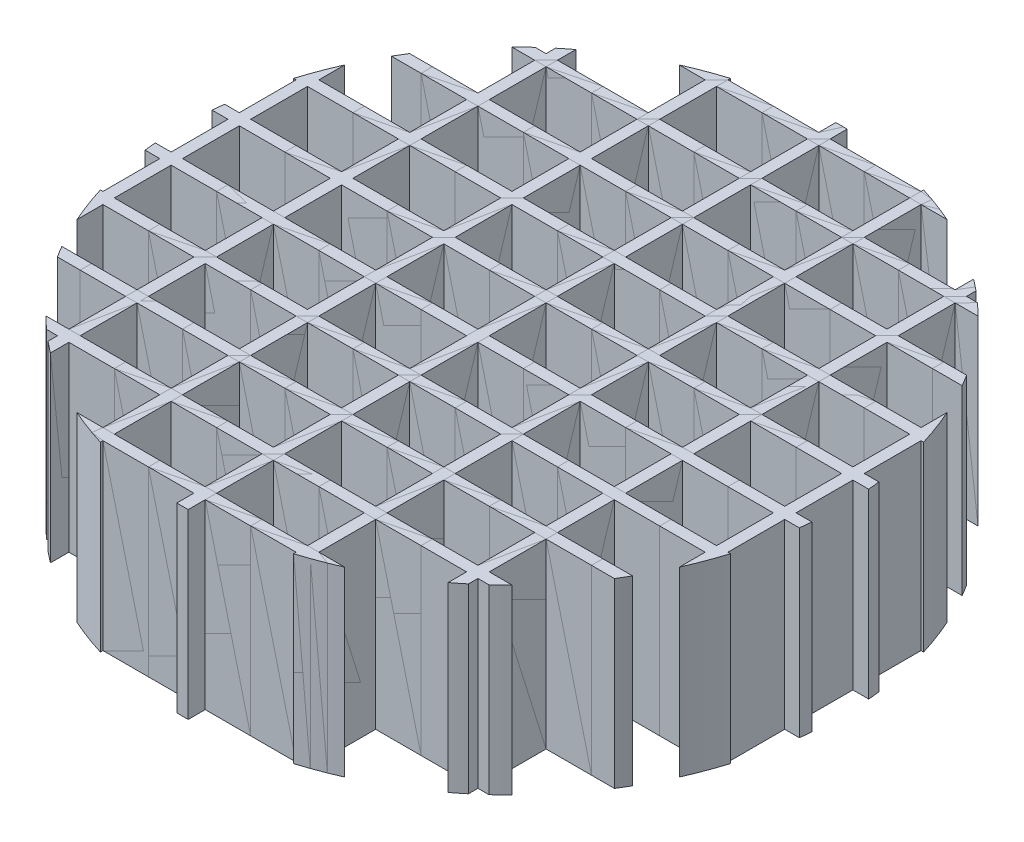
from build123d import *

# Parameters (mm, degrees)
SKETCH1_W                  = 3.175
SKETCH1_H                  = 190.5
BOSS_EXTRUDE1_DEPTH        = 50.8
SKETCH2_W                  = 3.175
SKETCH2_H                  = 50.8
BOSS_EXTRUDE2_DEPTH        = 12.7
LPATTERN1_COUNT            = 10
LPATTERN1_PITCH            = 19.05
LPATTERN2_COPY_1_SKETCH_W  = 3.175
LPATTERN2_COPY_1_SKETCH_H  = 50.8
LPATTERN2_COPY_1_DEPTH     = 12.7
LPATTERN2_COPY_2_SKETCH_W  = 3.175
LPATTERN2_COPY_2_SKETCH_H  = 50.8
LPATTERN2_COPY_2_DEPTH     = 12.7
LPATTERN2_COPY_3_SKETCH_W  = 3.175
LPATTERN2_COPY_3_SKETCH_H  = 50.8
LPATTERN2_COPY_3_DEPTH     = 12.7
LPATTERN2_COPY_4_SKETCH_W  = 3.175
LPATTERN2_COPY_4_SKETCH_H  = 50.8
LPATTERN2_COPY_4_DEPTH     = 12.7
LPATTERN2_COPY_5_SKETCH_W  = 3.175
LPATTERN2_COPY_5_SKETCH_H  = 50.8
LPATTERN2_COPY_5_DEPTH     = 12.7
LPATTERN2_COPY_6_SKETCH_W  = 3.175
LPATTERN2_COPY_6_SKETCH_H  = 50.8
LPATTERN2_COPY_6_DEPTH     = 12.7
LPATTERN2_COPY_7_SKETCH_W  = 3.175
LPATTERN2_COPY_7_SKETCH_H  = 50.8
LPATTERN2_COPY_7_DEPTH     = 12.7
LPATTERN2_COPY_8_SKETCH_W  = 3.175
LPATTERN2_COPY_8_SKETCH_H  = 50.8
LPATTERN2_COPY_8_DEPTH     = 12.7
LPATTERN2_COPY_9_SKETCH_W  = 3.175
LPATTERN2_COPY_9_SKETCH_H  = 50.8
LPATTERN2_COPY_9_DEPTH     = 12.7
LPATTERN2_COPY_10_SKETCH_W = 3.175
LPATTERN2_COPY_10_SKETCH_H = 50.8
LPATTERN2_COPY_10_DEPTH    = 12.7
LPATTERN3_COUNT            = 4
LPATTERN3_PITCH            = 28.575
LPATTERN3_2_COUNT          = 4
LPATTERN3_2_PITCH          = 28.575
SKETCH3_R                  = 152.4
SKETCH3_R_2                = 92.075
CUT_EXTRUDE1_DEPTH         = 148.158766834


with BuildPart() as part:
    # Sketch1 → Boss-Extrude1 (new body)
    with BuildSketch(Plane(origin=(0, 0, 0), x_dir=(1, 0, 0), z_dir=(0, 1, 0))):
        Rectangle(SKETCH1_W, SKETCH1_H)
    extrude(amount=BOSS_EXTRUDE1_DEPTH)

    # Sketch2 → Boss-Extrude2 (add)
    with BuildSketch(Plane(origin=(1.5875, 0, 0), x_dir=(0, 0, -1), z_dir=(1, 0, 0))):
        with Locations((-85.725, 25.4)):
            Rectangle(SKETCH2_W, SKETCH2_H)
    boss_extrude2 = extrude(amount=BOSS_EXTRUDE2_DEPTH)

    # LPattern1: Boss-Extrude2 ×10
    with Locations(*[(0, 0, -i * LPATTERN1_PITCH) for i in range(1, LPATTERN1_COUNT)]):
        add(boss_extrude2)

    # LPattern2 copy 1 sketch → LPattern2 copy 1 (add)
    with BuildSketch(Plane(origin=(-14.2875, 0, -19.05), x_dir=(0, 0, -1), z_dir=(1, 0, 0))):
        with Locations((-85.725, 25.4)):
            Rectangle(LPATTERN2_COPY_1_SKETCH_W, LPATTERN2_COPY_1_SKETCH_H)
    extrude(amount=LPATTERN2_COPY_1_DEPTH)

    # LPattern2 copy 2 sketch → LPattern2 copy 2 (add)
    with BuildSketch(Plane(origin=(-14.2875, 0, -38.1), x_dir=(0, 0, -1), z_dir=(1, 0, 0))):
        with Locations((-85.725, 25.4)):
            Rectangle(LPATTERN2_COPY_2_SKETCH_W, LPATTERN2_COPY_2_SKETCH_H)
    extrude(amount=LPATTERN2_COPY_2_DEPTH)

    # LPattern2 copy 3 sketch → LPattern2 copy 3 (add)
    with BuildSketch(Plane(origin=(-14.2875, 0, -57.15), x_dir=(0, 0, -1), z_dir=(1, 0, 0))):
        with Locations((-85.725, 25.4)):
            Rectangle(LPATTERN2_COPY_3_SKETCH_W, LPATTERN2_COPY_3_SKETCH_H)
    extrude(amount=LPATTERN2_COPY_3_DEPTH)

    # LPattern2 copy 4 sketch → LPattern2 copy 4 (add)
    with BuildSketch(Plane(origin=(-14.2875, 0, -76.2), x_dir=(0, 0, -1), z_dir=(1, 0, 0))):
        with Locations((-85.725, 25.4)):
            Rectangle(LPATTERN2_COPY_4_SKETCH_W, LPATTERN2_COPY_4_SKETCH_H)
    extrude(amount=LPATTERN2_COPY_4_DEPTH)

    # LPattern2 copy 5 sketch → LPattern2 copy 5 (add)
    with BuildSketch(Plane(origin=(-14.2875, 0, -95.25), x_dir=(0, 0, -1), z_dir=(1, 0, 0))):
        with Locations((-85.725, 25.4)):
            Rectangle(LPATTERN2_COPY_5_SKETCH_W, LPATTERN2_COPY_5_SKETCH_H)
    extrude(amount=LPATTERN2_COPY_5_DEPTH)

    # LPattern2 copy 6 sketch → LPattern2 copy 6 (add)
    with BuildSketch(Plane(origin=(-14.2875, 0, -114.3), x_dir=(0, 0, -1), z_dir=(1, 0, 0))):
        with Locations((-85.725, 25.4)):
            Rectangle(LPATTERN2_COPY_6_SKETCH_W, LPATTERN2_COPY_6_SKETCH_H)
    extrude(amount=LPATTERN2_COPY_6_DEPTH)

    # LPattern2 copy 7 sketch → LPattern2 copy 7 (add)
    with BuildSketch(Plane(origin=(-14.2875, 0, -133.35), x_dir=(0, 0, -1), z_dir=(1, 0, 0))):
        with Locations((-85.725, 25.4)):
            Rectangle(LPATTERN2_COPY_7_SKETCH_W, LPATTERN2_COPY_7_SKETCH_H)
    extrude(amount=LPATTERN2_COPY_7_DEPTH)

    # LPattern2 copy 8 sketch → LPattern2 copy 8 (add)
    with BuildSketch(Plane(origin=(-14.2875, 0, -152.4), x_dir=(0, 0, -1), z_dir=(1, 0, 0))):
        with Locations((-85.725, 25.4)):
            Rectangle(LPATTERN2_COPY_8_SKETCH_W, LPATTERN2_COPY_8_SKETCH_H)
    extrude(amount=LPATTERN2_COPY_8_DEPTH)

    # LPattern2 copy 9 sketch → LPattern2 copy 9 (add)
    with BuildSketch(Plane(origin=(-14.2875, 0, -171.45), x_dir=(0, 0, -1), z_dir=(1, 0, 0))):
        with Locations((-85.725, 25.4)):
            Rectangle(LPATTERN2_COPY_9_SKETCH_W, LPATTERN2_COPY_9_SKETCH_H)
    extrude(amount=LPATTERN2_COPY_9_DEPTH)

    # LPattern2 copy 10 sketch → LPattern2 copy 10 (add)
    with BuildSketch(Plane(origin=(-14.2875, 0, 0), x_dir=(0, 0, -1), z_dir=(1, 0, 0))):
        with Locations((-85.725, 25.4)):
            Rectangle(LPATTERN2_COPY_10_SKETCH_W, LPATTERN2_COPY_10_SKETCH_H)
    extrude(amount=LPATTERN2_COPY_10_DEPTH)


with BuildPart() as lpattern3_1:
    # LPattern3: pattern copy
    add(part.part.moved(Location(Vector(1, 0, 0) * (1 * LPATTERN3_PITCH))))


with BuildPart() as lpattern3_2:
    # LPattern3: pattern copy
    add(part.part.moved(Location(Vector(1, 0, 0) * (2 * LPATTERN3_PITCH))))


with BuildPart() as lpattern3_3:
    # LPattern3: pattern copy
    add(part.part.moved(Location(Vector(1, 0, 0) * (3 * LPATTERN3_PITCH))))


with BuildPart() as lpattern3_2_1:
    # LPattern3 2: pattern copy
    add(part.part.moved(Location(Vector(-1, 0, 0) * (1 * LPATTERN3_2_PITCH))))


with BuildPart() as lpattern3_2_2:
    # LPattern3 2: pattern copy
    add(part.part.moved(Location(Vector(-1, 0, 0) * (2 * LPATTERN3_2_PITCH))))


with BuildPart() as lpattern3_2_3:
    # LPattern3 2: pattern copy
    add(part.part.moved(Location(Vector(-1, 0, 0) * (3 * LPATTERN3_2_PITCH))))


with BuildPart() as lpattern3_2_4:
    # LPattern3 2: pattern copy
    add(lpattern3_1.part.moved(Location(Vector(-1, 0, 0) * (1 * LPATTERN3_2_PITCH))))


with BuildPart() as lpattern3_2_5:
    # LPattern3 2: pattern copy
    add(lpattern3_1.part.moved(Location(Vector(-1, 0, 0) * (2 * LPATTERN3_2_PITCH))))


with BuildPart() as lpattern3_2_6:
    # LPattern3 2: pattern copy
    add(lpattern3_1.part.moved(Location(Vector(-1, 0, 0) * (3 * LPATTERN3_2_PITCH))))


with BuildPart() as lpattern3_2_7:
    # LPattern3 2: pattern copy
    add(lpattern3_2.part.moved(Location(Vector(-1, 0, 0) * (1 * LPATTERN3_2_PITCH))))


with BuildPart() as lpattern3_2_8:
    # LPattern3 2: pattern copy
    add(lpattern3_2.part.moved(Location(Vector(-1, 0, 0) * (2 * LPATTERN3_2_PITCH))))


with BuildPart() as lpattern3_2_9:
    # LPattern3 2: pattern copy
    add(lpattern3_2.part.moved(Location(Vector(-1, 0, 0) * (3 * LPATTERN3_2_PITCH))))


with BuildPart() as lpattern3_2_10:
    # LPattern3 2: pattern copy
    add(lpattern3_3.part.moved(Location(Vector(-1, 0, 0) * (1 * LPATTERN3_2_PITCH))))


with BuildPart() as lpattern3_2_11:
    # LPattern3 2: pattern copy
    add(lpattern3_3.part.moved(Location(Vector(-1, 0, 0) * (2 * LPATTERN3_2_PITCH))))


with BuildPart() as lpattern3_2_12:
    # LPattern3 2: pattern copy
    add(lpattern3_3.part.moved(Location(Vector(-1, 0, 0) * (3 * LPATTERN3_2_PITCH))))


with BuildPart() as cut_extrude1_tool:
    # Sketch3 → Cut-Extrude1 (new, through all)
    with BuildSketch(Plane(origin=(0, 50.8, 0), x_dir=(1, 0, 0), z_dir=(0, 1, 0))):
        Circle(SKETCH3_R)
        Circle(SKETCH3_R_2, mode=Mode.SUBTRACT)
    extrude(amount=-CUT_EXTRUDE1_DEPTH)


with BuildPart() as part_1:
    add(part.part)

    # Cut-Extrude1: cut by cut_extrude1_tool
    add(cut_extrude1_tool.part, mode=Mode.SUBTRACT)


with BuildPart() as lpattern3_1_1:
    add(lpattern3_1.part)

    # Cut-Extrude1: cut by cut_extrude1_tool
    add(cut_extrude1_tool.part, mode=Mode.SUBTRACT)


with BuildPart() as lpattern3_2_13:
    add(lpattern3_2.part)

    # Cut-Extrude1: cut by cut_extrude1_tool
    add(cut_extrude1_tool.part, mode=Mode.SUBTRACT)


with BuildPart() as lpattern3_3_1:
    add(lpattern3_3.part)

    # Cut-Extrude1: cut by cut_extrude1_tool
    add(cut_extrude1_tool.part, mode=Mode.SUBTRACT)


with BuildPart() as lpattern3_2_1_1:
    add(lpattern3_2_1.part)

    # Cut-Extrude1: cut by cut_extrude1_tool
    add(cut_extrude1_tool.part, mode=Mode.SUBTRACT)


with BuildPart() as lpattern3_2_2_1:
    add(lpattern3_2_2.part)

    # Cut-Extrude1: cut by cut_extrude1_tool
    add(cut_extrude1_tool.part, mode=Mode.SUBTRACT)


with BuildPart() as lpattern3_2_3_1:
    add(lpattern3_2_3.part)

    # Cut-Extrude1: cut by cut_extrude1_tool
    add(cut_extrude1_tool.part, mode=Mode.SUBTRACT)


with BuildPart() as lpattern3_2_4_1:
    add(lpattern3_2_4.part)

    # Cut-Extrude1: cut by cut_extrude1_tool
    add(cut_extrude1_tool.part, mode=Mode.SUBTRACT)


with BuildPart() as lpattern3_2_5_1:
    add(lpattern3_2_5.part)

    # Cut-Extrude1: cut by cut_extrude1_tool
    add(cut_extrude1_tool.part, mode=Mode.SUBTRACT)


with BuildPart() as lpattern3_2_6_1:
    add(lpattern3_2_6.part)

    # Cut-Extrude1: cut by cut_extrude1_tool
    add(cut_extrude1_tool.part, mode=Mode.SUBTRACT)


with BuildPart() as lpattern3_2_7_1:
    add(lpattern3_2_7.part)

    # Cut-Extrude1: cut by cut_extrude1_tool
    add(cut_extrude1_tool.part, mode=Mode.SUBTRACT)


with BuildPart() as lpattern3_2_8_1:
    add(lpattern3_2_8.part)

    # Cut-Extrude1: cut by cut_extrude1_tool
    add(cut_extrude1_tool.part, mode=Mode.SUBTRACT)


with BuildPart() as lpattern3_2_9_1:
    add(lpattern3_2_9.part)

    # Cut-Extrude1: cut by cut_extrude1_tool
    add(cut_extrude1_tool.part, mode=Mode.SUBTRACT)


with BuildPart() as lpattern3_2_10_1:
    add(lpattern3_2_10.part)

    # Cut-Extrude1: cut by cut_extrude1_tool
    add(cut_extrude1_tool.part, mode=Mode.SUBTRACT)


with BuildPart() as lpattern3_2_11_1:
    add(lpattern3_2_11.part)

    # Cut-Extrude1: cut by cut_extrude1_tool
    add(cut_extrude1_tool.part, mode=Mode.SUBTRACT)


with BuildPart() as lpattern3_2_12_1:
    add(lpattern3_2_12.part)

    # Cut-Extrude1: cut by cut_extrude1_tool
    add(cut_extrude1_tool.part, mode=Mode.SUBTRACT)


solid = Compound([part_1.part, lpattern3_1_1.part, lpattern3_2_13.part, lpattern3_3_1.part, lpattern3_2_1_1.part, lpattern3_2_2_1.part, lpattern3_2_3_1.part, lpattern3_2_4_1.part, lpattern3_2_5_1.part, lpattern3_2_6_1.part, lpattern3_2_7_1.part, lpattern3_2_8_1.part, lpattern3_2_9_1.part, lpattern3_2_10_1.part, lpattern3_2_11_1.part, lpattern3_2_12_1.part])
